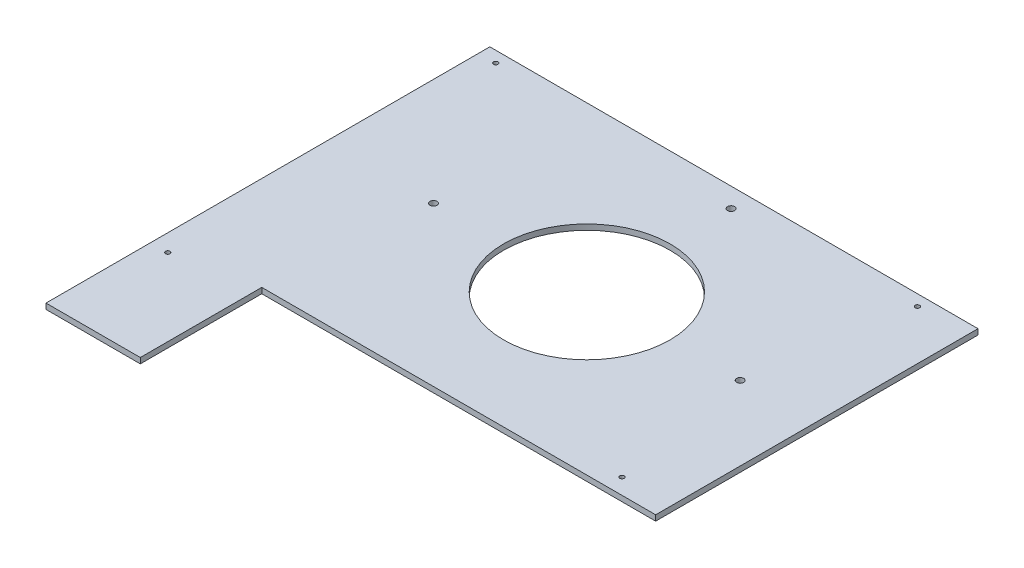
from build123d import *

# Parameters (mm, degrees)
CROQUIS2_R              = 75
CROQUIS2_R_2            = 2
CROQUIS2_R_3            = 3.175
SALIENTE_EXTRUIR2_DEPTH = 5


with BuildPart() as part:
    # Croquis2 → Saliente-Extruir2 (new body)
    with BuildSketch(Plane(origin=(0, 0, 0), x_dir=(1, 0, 0), z_dir=(0, 1, 0))):
        Polygon((-164.024069274, 177.568942162), (-164.024069274, -142.431057838), (-164.024069274, -189.256710106), (-164.024069274, -222.426710106), (-79.024069274, -222.426710106), (-79.024069274, -189.256710106), (-79.024069274, -142.431057838), (-79.024069274, -112.958468136), (275.975930726, -112.958468136), (275.975930726, 177.568942162), align=None)
        with Locations((70.975930726, 30.02579809)):
            Circle(CROQUIS2_R, mode=Mode.SUBTRACT)
        with Locations((-148.613055051, 167.568942162)):
            Circle(CROQUIS2_R_2, mode=Mode.SUBTRACT)
        with Locations((-148.613055051, -128.145081947)):
            Circle(CROQUIS2_R_2, mode=Mode.SUBTRACT)
        with Locations((231.386944949, -98.672492245)):
            Circle(CROQUIS2_R_2, mode=Mode.SUBTRACT)
        with Locations((231.386944949, 167.568942162)):
            Circle(CROQUIS2_R_2, mode=Mode.SUBTRACT)
        with Locations((209.175930726, 30.02579809)):
            Circle(CROQUIS2_R_3, mode=Mode.SUBTRACT)
        with Locations((-67.224069274, 30.02579809)):
            Circle(CROQUIS2_R_3, mode=Mode.SUBTRACT)
        with Locations((70.975930726, 160.02579809)):
            Circle(CROQUIS2_R_3, mode=Mode.SUBTRACT)
    extrude(amount=SALIENTE_EXTRUIR2_DEPTH)


solid = part.part
